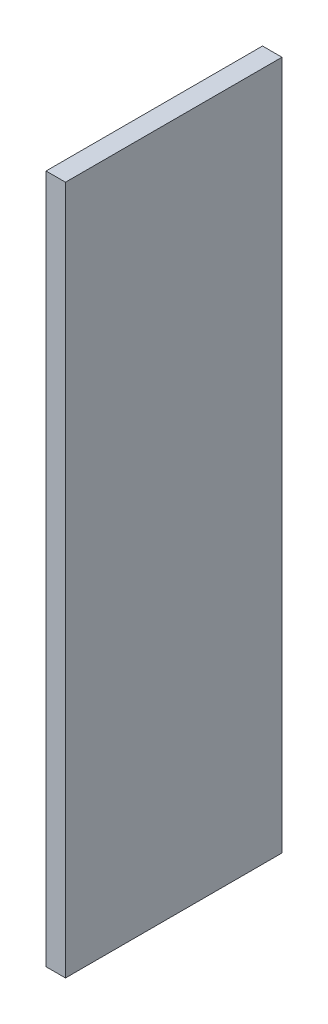
from build123d import *

# Parameters (mm, degrees)
SKETCH1_W           = 203.2
SKETCH1_H           = 646.938
BOSS_EXTRUDE1_DEPTH = 18.25625


with BuildPart() as part:
    # Sketch1 → Boss-Extrude1 (new body)
    with BuildSketch(Plane(origin=(0, 0, 0), x_dir=(0, 0, -1), z_dir=(1, 0, 0))):
        with Locations((71.133366082, 275.488612452)):
            Rectangle(SKETCH1_W, SKETCH1_H)
    extrude(amount=BOSS_EXTRUDE1_DEPTH)


solid = part.part
